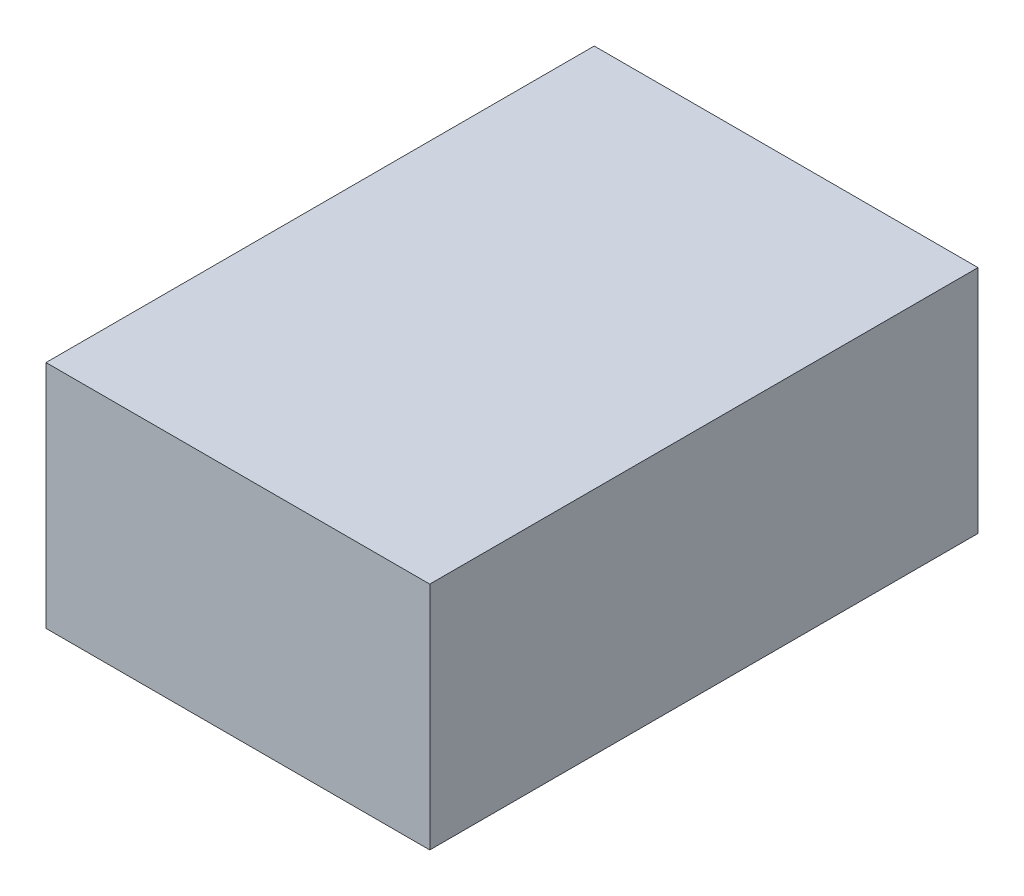
from build123d import *

# Parameters (mm, degrees)
SKETCH1_W           = 8.89
SKETCH1_H           = 5.334
BOSS_EXTRUDE1_DEPTH = 12.7


with BuildPart() as part:
    # Sketch1 → Boss-Extrude1 (new body)
    with BuildSketch(Plane.XY):
        with Locations((-0.160389822, 2.568239623)):
            Rectangle(SKETCH1_W, SKETCH1_H)
    extrude(amount=BOSS_EXTRUDE1_DEPTH)


solid = part.part
